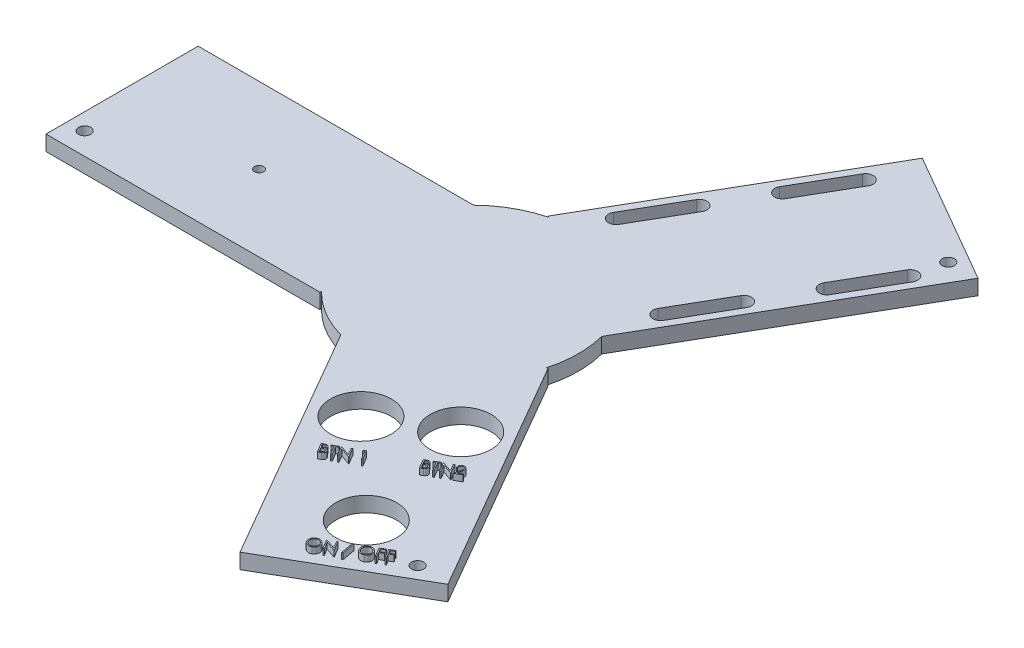
from build123d import *

# Parameters (mm, degrees)
BOSS_EXTRU_3_DEPTH      = 5
ESQUISSE5_R             = 10
ESQUISSE5_R_2           = 1.5
ENL_V_MAT_EXTRU_1_DEPTH = 161.669919512
ESQUISSE7_R             = 2
ENL_V_MAT_EXTRU_2_DEPTH = 10
BOSS_EXTRU_4_DEPTH      = 2


with BuildPart() as part:
    # Esquisse3 → Boss.-Extru.3 (new body)
    with BuildSketch(Plane(origin=(0, 0, 0), x_dir=(1, 0, 0), z_dir=(0, 1, 0))):
        with BuildLine():
            Line((-115, -25), (-25, -25))
            Line((-25, -25), (-24.99494949, -24.500051021))
            ThreePointArc((-24.99494949, -24.500051021), (-17.805293657, -30.132565736), (-9.403186381, -33.713203436))
            Line((-9.403186381, -33.713203436), (35.849364905, -112.092921435))
            Line((35.849364905, -112.092921435), (79.150635095, -87.092921435))
            Line((79.150635095, -87.092921435), (34.150635095, -9.150635095))
            Line((34.150635095, -9.150635095), (33.715141323, -9.396235714))
            ThreePointArc((33.715141323, -9.396235714), (34.998214236, -0.353553761), (33.898083809, 8.713203436))
            Line((33.898083809, 8.713203436), (79.150635095, 87.092921435))
            Line((79.150635095, 87.092921435), (35.849364905, 112.092921435))
            Line((35.849364905, 112.092921435), (-9.150635095, 34.150635095))
            Line((-9.150635095, 34.150635095), (-8.720191833, 33.896286735))
            ThreePointArc((-8.720191833, 33.896286735), (-17.19292058, 30.486119496), (-24.494897428, 25))
            Line((-24.494897428, 25), (-115, 25))
            Line((-115, 25), (-115, -25))
        make_face()
    extrude(amount=BOSS_EXTRU_3_DEPTH)

    # Esquisse5 → Enlèv. mat.-Extru.1 (cut, through all)
    with BuildSketch(Plane(origin=(0, 5, 0), x_dir=(1, 0, 0), z_dir=(0, 1, 0))):
        with BuildLine():
            Line((59.485571585, 58.032032303), (69.485571585, 75.352540378))
            ThreePointArc((69.485571585, 75.352540378), (68.570508076, 78.767603888), (65.155444566, 77.852540378))
            Line((65.155444566, 77.852540378), (55.155444566, 60.532032303))
            ThreePointArc((55.155444566, 60.532032303), (56.070508076, 57.116968793), (59.485571585, 58.032032303))
        make_face()
        with BuildLine():
            ThreePointArc((49.485571585, 40.711524227), (48.570508076, 44.126587737), (45.155444566, 43.211524227))
            Line((45.155444566, 43.211524227), (35.155444566, 25.891016151))
            ThreePointArc((35.155444566, 25.891016151), (36.070508076, 22.475952642), (39.485571585, 23.391016151))
            Line((39.485571585, 23.391016151), (49.485571585, 40.711524227))
        make_face()
        with BuildLine():
            ThreePointArc((20.514428415, 80.532032303), (21.429491924, 77.116968793), (24.844555434, 78.032032303))
            Line((24.844555434, 78.032032303), (34.844555434, 95.352540378))
            ThreePointArc((34.844555434, 95.352540378), (33.929491924, 98.767603888), (30.514428415, 97.852540378))
            Line((30.514428415, 97.852540378), (20.514428415, 80.532032303))
        make_face()
        with BuildLine():
            Line((10.514428415, 63.211524227), (0.514428415, 45.891016151))
            ThreePointArc((0.514428415, 45.891016151), (1.429491924, 42.475952642), (4.844555434, 43.391016151))
            Line((4.844555434, 43.391016151), (14.844555434, 60.711524227))
            ThreePointArc((14.844555434, 60.711524227), (13.929491924, 64.126587737), (10.514428415, 63.211524227))
        make_face()
        with Locations((47.5, -82.272413359)):
            Circle(ESQUISSE5_R)
        with Locations((-70, 0)):
            Circle(ESQUISSE5_R_2)
        with Locations((17.107695155, -53.631397208)):
            Circle(ESQUISSE5_R)
        with Locations((37.892304845, -41.631397208)):
            Circle(ESQUISSE5_R)
    extrude(amount=-ENL_V_MAT_EXTRU_1_DEPTH, mode=Mode.SUBTRACT)

    # Esquisse7 → Enlèv. mat.-Extru.2 (cut)
    with BuildSketch(Plane(origin=(0, 5, 0), x_dir=(1, 0, 0), z_dir=(0, 1, 0))):
        with Locations((69.722431864, 86.762794416)):
            Circle(ESQUISSE7_R)
        with Locations((-109.562568341, -17.757653858)):
            Circle(ESQUISSE7_R)
        with Locations((68.847568546, -86.762794416)):
            Circle(ESQUISSE7_R)
    extrude(amount=-ENL_V_MAT_EXTRU_2_DEPTH, mode=Mode.SUBTRACT)

    # Esquisse8 → Boss.-Extru.4 (add)
    # profile 1 of 14: a face of its own
    with BuildSketch(Plane(origin=(0, 5, 0), x_dir=(1, 0, 0), z_dir=(0, 1, 0))):
        with BuildLine():
            add(Edge.make_bspline(
                [(46.348522792, -97.586053463), (46.405503778, -97.555102837), (46.517663732, -97.494180394), (46.692297521, -97.421902491), (46.868328496, -97.367882687), (47.045849557, -97.333837549), (47.224280836, -97.316279004), (47.404056439, -97.318820115), (47.585091186, -97.339363632), (47.765377634, -97.377780108), (47.940925593, -97.432800451), (48.10820551, -97.502842435), (48.264467762, -97.588976654), (48.410594458, -97.689408434), (48.545030687, -97.806072132), (48.66874809, -97.937282993), (48.782886683, -98.082898468), (48.847899457, -98.189481549), (48.880974716, -98.243705707)],
                knots=[0, 0, 0, 0, 1.065304014, 2.096917889, 3.100711503, 4.086921898, 5.063206018, 6.042877862, 7.036430753, 8.053587743, 9.068122506, 10.05630619, 11.029433465, 11.995941318, 12.965559079, 13.949274792, 14.956693254, 16, 16, 16, 16], degree=3))
            add(Edge.make_bspline(
                [(48.880974716, -98.243705707), (48.911063825, -98.299021258), (48.970226315, -98.407785053), (49.038876531, -98.578364448), (49.09048604, -98.750321046), (49.124082064, -98.924840994), (49.137651126, -99.101405381), (49.134040592, -99.279840025), (49.113110516, -99.460307142), (49.072800376, -99.640365444), (49.017479335, -99.816191579), (48.947319225, -99.98372487), (48.861506016, -100.139990775), (48.760295013, -100.285329569), (48.645371328, -100.42032379), (48.514945274, -100.543793171), (48.37019178, -100.656821243), (48.264432042, -100.721542249), (48.21070228, -100.754422854)],
                knots=[0, 0, 0, 0, 1.043720089, 2.052206943, 3.04317604, 4.017816421, 4.99386645, 5.974776854, 6.973915512, 8.001918398, 9.030498486, 10.027627402, 11.009563614, 11.981633653, 12.96044316, 13.944771313, 14.955869685, 16, 16, 16, 16], degree=3))
            add(Edge.make_bspline(
                [(48.21070228, -100.754422854), (48.154960598, -100.785072437), (48.045246366, -100.845398847), (47.87287117, -100.913995029), (47.699810156, -100.967190789), (47.524069907, -100.999769327), (47.346792742, -101.015573736), (47.167756969, -101.012589636), (46.987182989, -100.991244224), (46.807264417, -100.95200615), (46.631594824, -100.897229865), (46.464688371, -100.827142656), (46.309011555, -100.741930578), (46.16445673, -100.642387884), (46.030362012, -100.529130243), (45.908002824, -100.400599493), (45.796384075, -100.257770769), (45.732431259, -100.153751151), (45.699985132, -100.100977342)],
                knots=[0, 0, 0, 0, 1.056025618, 2.078535076, 3.07607539, 4.060055105, 5.042332339, 6.028776198, 7.029666655, 8.058644315, 9.08415774, 10.083034931, 11.061420663, 12.0275854, 12.99464712, 13.972400756, 14.971308138, 16, 16, 16, 16], degree=3))
            add(Edge.make_bspline(
                [(45.699985132, -100.100977342), (45.67992532, -100.064508607), (45.640005676, -99.991934703), (45.588125686, -99.879882478), (45.544743363, -99.765603736), (45.507903558, -99.650153555), (45.479874966, -99.532459091), (45.45977679, -99.412966537), (45.44601455, -99.291744139), (45.441476782, -99.169213355), (45.444093611, -99.047210796), (45.454698889, -98.92659888), (45.472812227, -98.8082961), (45.498743952, -98.692313928), (45.532761946, -98.578798197), (45.57391418, -98.467422827), (45.623329944, -98.358362732), (45.680030831, -98.252061021), (45.743270591, -98.149550796), (45.813243698, -98.052418949), (45.888143843, -97.960393536), (45.968990574, -97.873989209), (46.055404344, -97.793151831), (46.147529848, -97.718084394), (46.245009253, -97.648195381), (46.313868913, -97.606857104), (46.348522792, -97.586053463)],
                knots=[0, 0, 0, 0, 1.036687703, 2.063040393, 3.072945872, 4.080179394, 5.079981601, 6.084046655, 7.097336534, 8.117029152, 9.136173113, 10.135585345, 11.131106452, 12.11561961, 13.093759664, 14.08116077, 15.071355823, 16.074137165, 17.080714218, 18.069538995, 19.054327561, 20.034700321, 21.015073081, 21.999861646, 22.993422946, 24, 24, 24, 24], degree=3))
        make_face()
        with BuildLine():
            add(Edge.make_bspline(
                [(46.534320068, -97.874214521), (46.506737767, -97.890907072), (46.452068548, -97.923992372), (46.374340216, -97.980085184), (46.301054285, -98.040782624), (46.231726515, -98.106607941), (46.166764132, -98.177055979), (46.106314279, -98.252793504), (46.049193679, -98.332418456), (45.998048844, -98.41722349), (45.950548801, -98.504223903), (45.911309784, -98.594261662), (45.876151257, -98.684668466), (45.849112315, -98.777238351), (45.827321009, -98.870824033), (45.811476473, -98.966103713), (45.803637244, -99.062703287), (45.800598576, -99.160302644), (45.803843066, -99.258032621), (45.814838522, -99.355391495), (45.831043786, -99.451849783), (45.855853005, -99.547052656), (45.884563159, -99.641817883), (45.9217291, -99.735171338), (45.964110754, -99.82824227), (45.997759358, -99.888293781), (46.014788818, -99.918685675)],
                knots=[0, 0, 0, 0, 0.989056773, 1.960349877, 2.938319158, 3.907279331, 4.891957881, 5.876505827, 6.879480388, 7.896713311, 8.913870383, 9.918791872, 10.908472525, 11.888753296, 12.875180253, 13.856169139, 14.849636618, 15.846953908, 16.851670635, 17.847232811, 18.851821541, 19.85027285, 20.864264395, 21.888451632, 22.931351577, 24, 24, 24, 24], degree=3))
            add(Edge.make_bspline(
                [(46.014788818, -99.918685675), (46.041229031, -99.96230379), (46.093236122, -100.048099291), (46.185827377, -100.164620553), (46.285011617, -100.270609133), (46.394126496, -100.363438558), (46.510695573, -100.445733093), (46.637280781, -100.514098785), (46.771665618, -100.572315342), (46.913784326, -100.616331877), (47.059037204, -100.6476446), (47.204069604, -100.665736056), (47.347126229, -100.668362068), (47.488363424, -100.65738796), (47.62761168, -100.631065626), (47.765052046, -100.590918489), (47.900425766, -100.536210286), (47.986763688, -100.489321021), (48.030513978, -100.465560675)],
                knots=[0, 0, 0, 0, 1.052030298, 2.069311486, 3.065878726, 4.044484931, 5.021567568, 6.006161727, 7.009027538, 8.040579081, 9.072062923, 10.073256091, 11.052872731, 12.02090789, 12.992747021, 13.972945674, 14.972824321, 16, 16, 16, 16], degree=3))
            add(Edge.make_bspline(
                [(48.030513978, -100.465560675), (48.059236785, -100.448128567), (48.116346776, -100.413468044), (48.197581753, -100.356096418), (48.273609013, -100.293881817), (48.345461073, -100.227838134), (48.412755193, -100.157343712), (48.474453151, -100.081668432), (48.532391106, -100.002450309), (48.584483187, -99.918588239), (48.63138975, -99.831989209), (48.672142946, -99.743464925), (48.70679889, -99.653357221), (48.734548596, -99.561673789), (48.756901308, -99.468592812), (48.770969856, -99.373774455), (48.78067354, -99.277614209), (48.782372953, -99.180129723), (48.778324264, -99.0824757), (48.767726077, -98.985278603), (48.750897561, -98.889253841), (48.727802746, -98.794055864), (48.697333975, -98.700047508), (48.660927618, -98.606819542), (48.618104976, -98.514521796), (48.585003261, -98.454784846), (48.568274395, -98.42459513)],
                knots=[0, 0, 0, 0, 1.027278423, 2.04255318, 3.038218543, 4.029565188, 5.025461382, 6.015596443, 7.013439751, 8.024807894, 9.032127512, 10.023474158, 11.003028664, 11.981957225, 12.951026501, 13.927473417, 14.91100897, 15.904671549, 16.906168241, 17.898261722, 18.892309764, 19.885561016, 20.891358236, 21.911977043, 22.944759978, 24, 24, 24, 24], degree=3))
            add(Edge.make_bspline(
                [(48.568274395, -98.42459513), (48.550624162, -98.395164158), (48.515797222, -98.337091797), (48.457957416, -98.254436805), (48.395340719, -98.177628659), (48.329683075, -98.104908918), (48.259085234, -98.03851808), (48.185528051, -97.97604931), (48.106657899, -97.920427595), (48.024872821, -97.869117565), (47.939796233, -97.823565805), (47.852639814, -97.783460318), (47.762700062, -97.750538955), (47.670999055, -97.722954294), (47.576717555, -97.702272216), (47.480368241, -97.686218115), (47.381651489, -97.678521921), (47.281707271, -97.675320826), (47.181750069, -97.679159048), (47.08311265, -97.687853649), (46.986400941, -97.703519766), (46.891723482, -97.725113143), (46.799103927, -97.753415543), (46.708357929, -97.787023702), (46.61965904, -97.826854021), (46.562854668, -97.858378697), (46.534320068, -97.874214521)],
                knots=[0, 0, 0, 0, 1.053686592, 2.079104582, 3.094629063, 4.095438722, 5.085380942, 6.068640285, 7.056472891, 8.046232977, 9.032029835, 10.018035681, 10.98993997, 11.970917813, 12.956453373, 13.952309776, 14.967935698, 15.99465893, 17.0216079, 18.037867598, 19.033724001, 20.027846115, 21.017762318, 22.005620996, 22.998161495, 24, 24, 24, 24], degree=3))
        make_face(mode=Mode.SUBTRACT)
    # profile 2 of 14: a face of its own
    with BuildSketch(Plane(origin=(0, 5, 0), x_dir=(1, 0, 0), z_dir=(0, 1, 0))):
        Polygon((50.353336675, -99.415280226), (48.603336675, -96.385732951), (48.669242124, -96.347872374), (52.02340879, -97.504022213), (50.68356504, -95.184711316), (50.982242925, -95.012235354), (52.732242925, -98.04178263), (52.664234111, -98.081045451), (49.343020169, -96.944527021), (50.666036996, -99.235091925), align=None)
    # profile 3 of 14: a face of its own
    with BuildSketch(Plane(origin=(0, 5, 0), x_dir=(1, 0, 0), z_dir=(0, 1, 0))):
        Polygon((54.185541392, -93.061714521), (54.95817761, -97.305604745), (54.643373925, -97.487896412), (53.867933219, -93.24470731), align=None)
    # profile 4 of 14: a face of its own
    with BuildSketch(Plane(origin=(0, 5, 0), x_dir=(1, 0, 0), z_dir=(0, 1, 0))):
        with BuildLine():
            add(Edge.make_bspline(
                [(57.268214903, -91.281566284), (57.325195889, -91.250615657), (57.437355843, -91.189693215), (57.611989632, -91.117415312), (57.788020607, -91.063395507), (57.965541668, -91.029350369), (58.143972946, -91.011791825), (58.323748549, -91.014332935), (58.504783297, -91.034876452), (58.685069744, -91.073292929), (58.860617703, -91.128313272), (59.027897621, -91.198355255), (59.184159872, -91.284489475), (59.330286568, -91.384921254), (59.464722797, -91.501584952), (59.588440201, -91.632795813), (59.702578793, -91.778411288), (59.767591568, -91.88499437), (59.800666826, -91.939218527)],
                knots=[0, 0, 0, 0, 1.065304014, 2.096917889, 3.100711503, 4.086921898, 5.063206018, 6.042877862, 7.036430753, 8.053587743, 9.068122506, 10.05630619, 11.029433465, 11.995941318, 12.965559079, 13.949274792, 14.956693254, 16, 16, 16, 16], degree=3))
            add(Edge.make_bspline(
                [(59.800666826, -91.939218527), (59.830755936, -91.994534078), (59.889918426, -92.103297873), (59.958568641, -92.273877269), (60.010178151, -92.445833866), (60.043774174, -92.620353814), (60.057343236, -92.796918201), (60.053732703, -92.975352845), (60.032802626, -93.155819962), (59.992492487, -93.335878265), (59.937171445, -93.511704399), (59.867011335, -93.67923769), (59.781198127, -93.835503595), (59.679987123, -93.98084239), (59.565063439, -94.11583661), (59.434637385, -94.239305992), (59.289883891, -94.352334063), (59.184124152, -94.417055069), (59.13039439, -94.449935675)],
                knots=[0, 0, 0, 0, 1.043720089, 2.052206943, 3.04317604, 4.017816421, 4.99386645, 5.974776854, 6.973915512, 8.001918398, 9.030498486, 10.027627402, 11.009563614, 11.981633653, 12.96044316, 13.944771313, 14.955869685, 16, 16, 16, 16], degree=3))
            add(Edge.make_bspline(
                [(59.13039439, -94.449935675), (59.074652709, -94.480585258), (58.964938476, -94.540911667), (58.79256328, -94.60950785), (58.619502267, -94.66270361), (58.443762018, -94.695282148), (58.266484852, -94.711086556), (58.08744908, -94.708102457), (57.906875099, -94.686757045), (57.726956528, -94.647518971), (57.551286934, -94.592742686), (57.384380481, -94.522655476), (57.228703665, -94.437443398), (57.084148841, -94.337900705), (56.950054122, -94.224643064), (56.827694934, -94.096112314), (56.716076186, -93.95328359), (56.652123369, -93.849263971), (56.619677243, -93.796490162)],
                knots=[0, 0, 0, 0, 1.056025618, 2.078535076, 3.07607539, 4.060055105, 5.042332339, 6.028776198, 7.029666655, 8.058644315, 9.08415774, 10.083034931, 11.061420663, 12.0275854, 12.99464712, 13.972400756, 14.971308138, 16, 16, 16, 16], degree=3))
            add(Edge.make_bspline(
                [(56.619677243, -93.796490162), (56.59961743, -93.760021427), (56.559697786, -93.687447524), (56.507817797, -93.575395299), (56.464435473, -93.461116557), (56.427595669, -93.345666375), (56.399567077, -93.227971912), (56.379468901, -93.108479357), (56.365706661, -92.987256959), (56.361168892, -92.864726175), (56.363785721, -92.742723616), (56.374390999, -92.622111701), (56.392504338, -92.503808921), (56.418436063, -92.387826749), (56.452454057, -92.274311018), (56.493606291, -92.162935648), (56.543022055, -92.053875553), (56.599722942, -91.947573841), (56.662962702, -91.845063617), (56.732935809, -91.747931769), (56.807835953, -91.655906356), (56.888682685, -91.569502029), (56.975096455, -91.488664652), (57.067221959, -91.413597214), (57.164701363, -91.343708201), (57.233561023, -91.302369925), (57.268214903, -91.281566284)],
                knots=[0, 0, 0, 0, 1.036687703, 2.063040393, 3.072945872, 4.080179394, 5.079981601, 6.084046655, 7.097336534, 8.117029152, 9.136173113, 10.135585345, 11.131106452, 12.11561961, 13.093759664, 14.08116077, 15.071355823, 16.074137165, 17.080714218, 18.069538995, 19.054327561, 20.034700321, 21.015073081, 21.999861646, 22.993422946, 24, 24, 24, 24], degree=3))
        make_face()
        with BuildLine():
            add(Edge.make_bspline(
                [(57.454012179, -91.569727342), (57.426429877, -91.586419893), (57.371760659, -91.619505193), (57.294032327, -91.675598005), (57.220746396, -91.736295444), (57.151418625, -91.802120762), (57.086456243, -91.8725688), (57.026006389, -91.948306325), (56.968885789, -92.027931277), (56.917740954, -92.11273631), (56.870240912, -92.199736724), (56.831001894, -92.289774483), (56.795843368, -92.380181287), (56.768804426, -92.472751171), (56.747013119, -92.566336854), (56.731168583, -92.661616533), (56.723329354, -92.758216108), (56.720290687, -92.855815464), (56.723535176, -92.953545441), (56.734530632, -93.050904316), (56.750735897, -93.147362603), (56.775545115, -93.242565477), (56.804255269, -93.337330704), (56.841421211, -93.430684158), (56.883802864, -93.52375509), (56.917451469, -93.583806602), (56.934480929, -93.614198495)],
                knots=[0, 0, 0, 0, 0.989056773, 1.960349877, 2.938319158, 3.907279331, 4.891957881, 5.876505827, 6.879480388, 7.896713311, 8.913870383, 9.918791872, 10.908472525, 11.888753296, 12.875180253, 13.856169139, 14.849636618, 15.846953908, 16.851670635, 17.847232811, 18.851821541, 19.85027285, 20.864264395, 21.888451632, 22.931351577, 24, 24, 24, 24], degree=3))
            add(Edge.make_bspline(
                [(56.934480929, -93.614198495), (56.960921141, -93.65781661), (57.012928232, -93.743612111), (57.105519488, -93.860133374), (57.204703728, -93.966121954), (57.313818607, -94.058951379), (57.430387683, -94.141245914), (57.556972891, -94.209611605), (57.691357728, -94.267828162), (57.833476436, -94.311844698), (57.978729315, -94.343157421), (58.123761715, -94.361248877), (58.26681834, -94.363874888), (58.408055534, -94.35290078), (58.547303791, -94.326578447), (58.684744156, -94.286431309), (58.820117876, -94.231723106), (58.906455799, -94.184833842), (58.950206089, -94.161073495)],
                knots=[0, 0, 0, 0, 1.052030298, 2.069311486, 3.065878726, 4.044484931, 5.021567568, 6.006161727, 7.009027538, 8.040579081, 9.072062923, 10.073256091, 11.052872731, 12.02090789, 12.992747021, 13.972945674, 14.972824321, 16, 16, 16, 16], degree=3))
            add(Edge.make_bspline(
                [(58.950206089, -94.161073495), (58.978928896, -94.143641388), (59.036038886, -94.108980865), (59.117273864, -94.051609238), (59.193301124, -93.989394638), (59.265153183, -93.923350955), (59.332447303, -93.852856533), (59.394145262, -93.777181252), (59.452083216, -93.697963129), (59.504175297, -93.61410106), (59.55108186, -93.52750203), (59.591835057, -93.438977746), (59.626491001, -93.348870042), (59.654240706, -93.25718661), (59.676593419, -93.164105632), (59.690661966, -93.069287275), (59.700365651, -92.97312703), (59.702065063, -92.875642544), (59.698016375, -92.77798852), (59.687418188, -92.680791423), (59.670589671, -92.584766661), (59.647494856, -92.489568685), (59.617026086, -92.395560328), (59.580619728, -92.302332362), (59.537797087, -92.210034616), (59.504695371, -92.150297667), (59.487966506, -92.120107951)],
                knots=[0, 0, 0, 0, 1.027278423, 2.04255318, 3.038218543, 4.029565188, 5.025461382, 6.015596443, 7.013439751, 8.024807894, 9.032127512, 10.023474158, 11.003028664, 11.981957225, 12.951026501, 13.927473417, 14.91100897, 15.904671549, 16.906168241, 17.898261722, 18.892309764, 19.885561016, 20.891358236, 21.911977043, 22.944759978, 24, 24, 24, 24], degree=3))
            add(Edge.make_bspline(
                [(59.487966506, -92.120107951), (59.470316273, -92.090676979), (59.435489333, -92.032604618), (59.377649527, -91.949949626), (59.31503283, -91.87314148), (59.249375186, -91.800421738), (59.178777345, -91.7340309), (59.105220162, -91.67156213), (59.026350009, -91.615940415), (58.944564931, -91.564630386), (58.859488344, -91.519078626), (58.772331924, -91.478973139), (58.682392172, -91.446051776), (58.590691166, -91.418467114), (58.496409666, -91.397785036), (58.400060351, -91.381730936), (58.301343599, -91.374034742), (58.201399382, -91.370833647), (58.10144218, -91.374671868), (58.002804761, -91.38336647), (57.906093052, -91.399032586), (57.811415593, -91.420625963), (57.718796038, -91.448928363), (57.628050039, -91.482536522), (57.539351151, -91.522366841), (57.482546779, -91.553891518), (57.454012179, -91.569727342)],
                knots=[0, 0, 0, 0, 1.053686592, 2.079104582, 3.094629063, 4.095438722, 5.085380942, 6.068640285, 7.056472891, 8.046232977, 9.032029835, 10.018035681, 10.98993997, 11.970917813, 12.956453373, 13.952309776, 14.967935698, 15.99465893, 17.0216079, 18.037867598, 19.033724001, 20.027846115, 21.017762318, 22.005620996, 22.998161495, 24, 24, 24, 24], degree=3))
        make_face(mode=Mode.SUBTRACT)
    # profile 5 of 14: a face of its own
    with BuildSketch(Plane(origin=(0, 5, 0), x_dir=(1, 0, 0), z_dir=(0, 1, 0))):
        Polygon((59.52092542, -90.082648015), (61.038854106, -89.206245771), (61.212031189, -89.504923656), (59.994883754, -90.207447694), (60.541758754, -91.154663239), (61.758906189, -90.452139201), (61.931382151, -90.750817085), (60.714234715, -91.453341124), (61.57170667, -92.938317085), (61.27092542, -93.11219529), align=None)
    # profile 6 of 14: a face of its own
    with BuildSketch(Plane(origin=(0, 5, 0), x_dir=(1, 0, 0), z_dir=(0, 1, 0))):
        Polygon((61.541651362, -88.915981348), (63.059580048, -88.039579104), (63.232757132, -88.338256989), (62.015609696, -89.040781027), (62.562484696, -89.987996572), (63.779632132, -89.285472534), (63.952108093, -89.584150418), (62.734960657, -90.286674457), (63.592432612, -91.771650418), (63.291651362, -91.945528624), align=None)
    # profile 7 of 14: a face of its own
    with BuildSketch(Plane(origin=(0, 5, 0), x_dir=(1, 0, 0), z_dir=(0, 1, 0))):
        with BuildLine():
            Line((20.281734937, -69.84100232), (20.878389585, -69.496751518))
            add(Edge.make_bspline(
                [(20.878389585, -69.496751518), (20.907753716, -69.480241315), (20.964909179, -69.448105226), (21.049317161, -69.403905057), (21.130435846, -69.365637509), (21.207981257, -69.333641726), (21.281465049, -69.306493667), (21.351635938, -69.286255413), (21.417719872, -69.270303819), (21.500769881, -69.25841226), (21.60106686, -69.254876948), (21.718598965, -69.267156372), (21.832508085, -69.298018894), (21.941091616, -69.3457583), (22.042979536, -69.407792343), (22.133950191, -69.484489765), (22.214864315, -69.573419873), (22.257559862, -69.64162147), (22.279230931, -69.676238698)],
                knots=[0, 0, 0, 0, 1.00882277, 1.963611082, 2.852810412, 3.693764693, 4.475302011, 5.197315872, 5.87981379, 6.509331813, 7.706891572, 8.875530348, 10.035100883, 11.22615964, 12.416930468, 13.594442862, 14.779006292, 16, 16, 16, 16], degree=3))
            add(Edge.make_bspline(
                [(22.279230931, -69.676238698), (22.297000098, -69.70993641), (22.331959724, -69.776234364), (22.367743485, -69.882337899), (22.389246645, -69.990787273), (22.394333603, -70.101444323), (22.38602935, -70.212817689), (22.358734108, -70.323124951), (22.317935111, -70.433172599), (22.277964434, -70.501980798), (22.257496155, -70.537216262)],
                knots=[0, 0, 0, 0, 1.007082055, 1.981365386, 2.951988574, 3.924522265, 4.905285294, 5.897146089, 6.923165649, 8, 8, 8, 8], degree=3))
            add(Edge.make_bspline(
                [(22.257496155, -70.537216262), (22.302732292, -70.529061048), (22.389085487, -70.513493212), (22.513857302, -70.50183854), (22.627055247, -70.502240776), (22.729856958, -70.513176314), (22.824953424, -70.535216595), (22.914411289, -70.568151856), (23.000836787, -70.60943954), (23.082290012, -70.661509737), (23.159089405, -70.721641049), (23.228541263, -70.790694008), (23.291349935, -70.86791115), (23.326391551, -70.92474334), (23.344234937, -70.953682608)],
                knots=[0, 0, 0, 0, 1.318574814, 2.517083834, 3.590090243, 4.561719895, 5.477546529, 6.383374621, 7.292176711, 8.220562028, 9.151656128, 10.085836364, 11.025297208, 12, 12, 12, 12], degree=3))
            add(Edge.make_bspline(
                [(23.344234937, -70.953682608), (23.360852853, -70.983951793), (23.393549002, -71.043507143), (23.429454852, -71.137580275), (23.45661287, -71.23228234), (23.47383128, -71.328361266), (23.478963791, -71.42621152), (23.474999163, -71.525124319), (23.459917221, -71.62541193), (23.434718622, -71.725627261), (23.400024744, -71.824574285), (23.354075459, -71.919744393), (23.297719581, -72.010304911), (23.231452659, -72.096461133), (23.154274419, -72.177347496), (23.067119813, -72.253653802), (22.969841758, -72.325760495), (22.899392192, -72.368410223), (22.863265386, -72.390281166)],
                knots=[0, 0, 0, 0, 0.975398264, 1.91911956, 2.839577739, 3.758730218, 4.672234973, 5.604877378, 6.553491324, 7.534403573, 8.523054412, 9.513228071, 10.516350308, 11.534145836, 12.581254995, 13.672298889, 14.806346004, 16, 16, 16, 16], degree=3))
            Line((22.863265386, -72.390281166), (22.031734937, -72.870549595))
            Line((22.031734937, -72.870549595), (20.281734937, -69.84100232))
        make_face()
        with BuildLine():
            Line((20.750084296, -69.966503121), (21.31028061, -70.936154563))
            Line((21.31028061, -70.936154563), (21.482756572, -70.836595268))
            add(Edge.make_bspline(
                [(21.482756572, -70.836595268), (21.508116067, -70.821832991), (21.557179989, -70.793271884), (21.626160879, -70.748826566), (21.689760455, -70.706992584), (21.746762363, -70.665755943), (21.7968607, -70.624729531), (21.842341365, -70.586812804), (21.880207487, -70.548715032), (21.922199108, -70.500387787), (21.96531312, -70.438328583), (22.003186722, -70.358796626), (22.030149056, -70.275903648), (22.041841868, -70.189660085), (22.043375034, -70.102967843), (22.030016446, -70.017759597), (22.005489258, -69.934681476), (21.978201519, -69.883609365), (21.964427245, -69.857829243)],
                knots=[0, 0, 0, 0, 1.137489387, 2.200741407, 3.180822876, 4.0888093, 4.926534352, 5.69114394, 6.383099183, 7.006193662, 8.172371991, 9.298983002, 10.410850136, 11.537206064, 12.66078879, 13.760255669, 14.869424406, 16, 16, 16, 16], degree=3))
            add(Edge.make_bspline(
                [(21.964427245, -69.857829243), (21.954195788, -69.841281121), (21.934151431, -69.808861843), (21.899993493, -69.764576013), (21.862256768, -69.726354098), (21.82200808, -69.69300397), (21.778717921, -69.664700322), (21.731721459, -69.643117164), (21.682487107, -69.626046001), (21.630029804, -69.61463982), (21.574468934, -69.610014672), (21.51587864, -69.611271485), (21.454251061, -69.620455096), (21.389026475, -69.634731715), (21.321146709, -69.657940072), (21.249888802, -69.686756163), (21.175635984, -69.722762527), (21.125757602, -69.750318841), (21.099944072, -69.764580044)],
                knots=[0, 0, 0, 0, 0.944679052, 1.850712253, 2.709650896, 3.548321, 4.385914801, 5.213681072, 6.053732967, 6.913196565, 7.813522414, 8.756016286, 9.752995404, 10.835317034, 11.994839053, 13.232264863, 14.56761565, 16, 16, 16, 16], degree=3))
            Line((21.099944072, -69.764580044), (20.750084296, -69.966503121))
        make_face(mode=Mode.SUBTRACT)
        with BuildLine():
            Line((21.486262181, -71.241142544), (22.157235739, -72.402901358))
            Line((22.157235739, -72.402901358), (22.531634777, -72.186955845))
            add(Edge.make_bspline(
                [(22.531634777, -72.186955845), (22.558124585, -72.171196333), (22.60935515, -72.140717868), (22.682278284, -72.094395648), (22.748851585, -72.049757042), (22.808799043, -72.006406371), (22.861373948, -71.963695166), (22.907147235, -71.922166227), (22.946880452, -71.88224747), (22.990260993, -71.830656553), (23.034002442, -71.763508427), (23.073497404, -71.67850794), (23.099933298, -71.588447784), (23.11261298, -71.495423423), (23.114131034, -71.4016479), (23.100108498, -71.310633998), (23.074985205, -71.222709236), (23.046547934, -71.169210001), (23.032235739, -71.142284371)],
                knots=[0, 0, 0, 0, 1.128202246, 2.181912311, 3.161815519, 4.061839135, 4.888852637, 5.639808157, 6.323373699, 6.948796293, 8.104300804, 9.244889197, 10.368281156, 11.526063399, 12.672411729, 13.787860727, 14.886652404, 16, 16, 16, 16], degree=3))
            add(Edge.make_bspline(
                [(23.032235739, -71.142284371), (23.011877636, -71.110329246), (22.971936306, -71.047635284), (22.892736642, -70.969204742), (22.800839774, -70.907383435), (22.697145081, -70.862618171), (22.584515817, -70.835485532), (22.465472086, -70.82628421), (22.340732164, -70.837127332), (22.258185179, -70.858485328), (22.215428848, -70.869547993)],
                knots=[0, 0, 0, 0, 0.972184658, 1.907365689, 2.84273992, 3.806561865, 4.79657477, 5.809537921, 6.865420418, 8, 8, 8, 8], degree=3))
            add(Edge.make_bspline(
                [(22.215428848, -70.869547993), (22.199714641, -70.874526537), (22.165585855, -70.885339151), (22.111979563, -70.906434113), (22.052440502, -70.933841692), (21.985269068, -70.964233928), (21.912414271, -71.001602729), (21.832691829, -71.043868642), (21.746780063, -71.091506508), (21.68744585, -71.12539031), (21.656634777, -71.142985493)],
                knots=[0, 0, 0, 0, 0.634679512, 1.378424079, 2.21639655, 3.158655646, 4.217224558, 5.368704359, 6.633620638, 8, 8, 8, 8], degree=3))
            Line((21.656634777, -71.142985493), (21.486262181, -71.241142544))
        make_face(mode=Mode.SUBTRACT)
    # profile 8 of 14: a face of its own
    with BuildSketch(Plane(origin=(0, 5, 0), x_dir=(1, 0, 0), z_dir=(0, 1, 0))):
        Polygon((22.55923519, -68.935421052), (22.388862594, -68.640949898), (24.051222369, -67.681114161), (24.221594965, -67.975585315), (23.545713555, -68.365409033), (25.125340959, -71.100485155), (24.816146247, -71.279271212), (23.236518844, -68.544195091), align=None)
    # profile 9 of 14: a face of its own
    with BuildSketch(Plane(origin=(0, 5, 0), x_dir=(1, 0, 0), z_dir=(0, 1, 0))):
        Polygon((26.234502514, -70.472207531), (24.484502514, -67.442660256), (24.550407963, -67.404799679), (27.904574629, -68.560949518), (26.564730879, -66.241638621), (26.863408764, -66.069162659), (28.613408764, -69.098709935), (28.54539995, -69.137972756), (25.224186008, -68.001454326), (26.547202835, -70.29201923), align=None)
    # profile 10 of 14: a face of its own
    with BuildSketch(Plane(origin=(0, 5, 0), x_dir=(1, 0, 0), z_dir=(0, 1, 0))):
        Polygon((29.180981198, -64.760055877), (29.776233602, -64.416506197), (31.526233602, -67.446053473), (31.225452352, -67.619931678), (29.647227191, -64.886958922), (29.171866615, -65.161097544), align=None)
    # profile 11 of 14: a face of its own
    with BuildSketch(Plane(origin=(0, 5, 0), x_dir=(1, 0, 0), z_dir=(0, 1, 0))):
        with BuildLine():
            Line((41.638906833, -57.653849312), (42.23556148, -57.30959851))
            add(Edge.make_bspline(
                [(42.23556148, -57.30959851), (42.264925611, -57.293088307), (42.322081074, -57.260952218), (42.406489056, -57.216752049), (42.487607741, -57.178484501), (42.565153152, -57.146488718), (42.638636944, -57.119340659), (42.708807834, -57.099102405), (42.774891767, -57.083150811), (42.857941777, -57.071259252), (42.958238755, -57.06772394), (43.07577086, -57.080003364), (43.18967998, -57.110865886), (43.298263511, -57.158605292), (43.400151431, -57.220639335), (43.491122087, -57.297336757), (43.57203621, -57.386266865), (43.614731757, -57.454468462), (43.636402826, -57.48908569)],
                knots=[0, 0, 0, 0, 1.00882277, 1.963611082, 2.852810412, 3.693764693, 4.475302011, 5.197315872, 5.87981379, 6.509331813, 7.706891572, 8.875530348, 10.035100883, 11.22615964, 12.416930468, 13.594442862, 14.779006292, 16, 16, 16, 16], degree=3))
            add(Edge.make_bspline(
                [(43.636402826, -57.48908569), (43.654171993, -57.522783402), (43.689131619, -57.589081356), (43.72491538, -57.695184891), (43.74641854, -57.803634265), (43.751505498, -57.914291315), (43.743201245, -58.025664681), (43.715906004, -58.135971943), (43.675107007, -58.246019591), (43.635136329, -58.31482779), (43.614668051, -58.350063254)],
                knots=[0, 0, 0, 0, 1.007082055, 1.981365386, 2.951988574, 3.924522265, 4.905285294, 5.897146089, 6.923165649, 8, 8, 8, 8], degree=3))
            add(Edge.make_bspline(
                [(43.614668051, -58.350063254), (43.659904187, -58.34190804), (43.746257382, -58.326340204), (43.871029197, -58.314685532), (43.984227142, -58.315087768), (44.087028853, -58.326023306), (44.18212532, -58.348063587), (44.271583185, -58.380998848), (44.358008682, -58.422286532), (44.439461907, -58.474356729), (44.516261301, -58.534488042), (44.585713159, -58.603541), (44.648521831, -58.680758142), (44.683563447, -58.737590332), (44.701406833, -58.7665296)],
                knots=[0, 0, 0, 0, 1.318574814, 2.517083834, 3.590090243, 4.561719895, 5.477546529, 6.383374621, 7.292176711, 8.220562028, 9.151656128, 10.085836364, 11.025297208, 12, 12, 12, 12], degree=3))
            add(Edge.make_bspline(
                [(44.701406833, -58.7665296), (44.718024748, -58.796798785), (44.750720897, -58.856354135), (44.786626748, -58.950427267), (44.813784765, -59.045129332), (44.831003175, -59.141208258), (44.836135686, -59.239058512), (44.832171059, -59.337971311), (44.817089116, -59.438258922), (44.791890518, -59.538474253), (44.757196639, -59.637421277), (44.711247355, -59.732591385), (44.654891476, -59.823151903), (44.588624554, -59.909308125), (44.511446314, -59.990194488), (44.424291708, -60.066500794), (44.327013653, -60.138607487), (44.256564087, -60.181257215), (44.220437282, -60.203128158)],
                knots=[0, 0, 0, 0, 0.975398264, 1.91911956, 2.839577739, 3.758730218, 4.672234973, 5.604877378, 6.553491324, 7.534403573, 8.523054412, 9.513228071, 10.516350308, 11.534145836, 12.581254995, 13.672298889, 14.806346004, 16, 16, 16, 16], degree=3))
            Line((44.220437282, -60.203128158), (43.388906833, -60.683396587))
            Line((43.388906833, -60.683396587), (41.638906833, -57.653849312))
        make_face()
        with BuildLine():
            Line((42.107256192, -57.779350113), (42.667452506, -58.749001555))
            Line((42.667452506, -58.749001555), (42.839928467, -58.64944226))
            add(Edge.make_bspline(
                [(42.839928467, -58.64944226), (42.865287962, -58.634679983), (42.914351884, -58.606118876), (42.983332774, -58.561673558), (43.046932351, -58.519839576), (43.103934259, -58.478602935), (43.154032595, -58.437576523), (43.19951326, -58.399659796), (43.237379383, -58.361562024), (43.279371003, -58.313234779), (43.322485016, -58.251175575), (43.360358617, -58.171643618), (43.387320951, -58.08875064), (43.399013763, -58.002507077), (43.40054693, -57.915814835), (43.387188342, -57.830606589), (43.362661153, -57.747528468), (43.335373414, -57.696456357), (43.32159914, -57.670676235)],
                knots=[0, 0, 0, 0, 1.137489387, 2.200741407, 3.180822876, 4.0888093, 4.926534352, 5.69114394, 6.383099183, 7.006193662, 8.172371991, 9.298983002, 10.410850136, 11.537206064, 12.66078879, 13.760255669, 14.869424406, 16, 16, 16, 16], degree=3))
            add(Edge.make_bspline(
                [(43.32159914, -57.670676235), (43.311367683, -57.654128113), (43.291323327, -57.621708835), (43.257165388, -57.577423005), (43.219428663, -57.53920109), (43.179179975, -57.505850962), (43.135889817, -57.477547314), (43.088893355, -57.455964156), (43.039659003, -57.438892993), (42.987201699, -57.427486812), (42.931640829, -57.422861664), (42.873050535, -57.424118477), (42.811422957, -57.433302088), (42.74619837, -57.447578707), (42.678318605, -57.470787064), (42.607060697, -57.499603155), (42.532807879, -57.535609519), (42.482929497, -57.563165833), (42.457115967, -57.577427036)],
                knots=[0, 0, 0, 0, 0.944679052, 1.850712253, 2.709650896, 3.548321, 4.385914801, 5.213681072, 6.053732967, 6.913196565, 7.813522414, 8.756016286, 9.752995404, 10.835317034, 11.994839053, 13.232264863, 14.56761565, 16, 16, 16, 16], degree=3))
            Line((42.457115967, -57.577427036), (42.107256192, -57.779350113))
        make_face(mode=Mode.SUBTRACT)
        with BuildLine():
            Line((42.843434076, -59.053989536), (43.514407634, -60.21574835))
            Line((43.514407634, -60.21574835), (43.888806673, -59.999802837))
            add(Edge.make_bspline(
                [(43.888806673, -59.999802837), (43.915296481, -59.984043325), (43.966527046, -59.95356486), (44.03945018, -59.90724264), (44.106023481, -59.862604034), (44.165970939, -59.819253363), (44.218545843, -59.776542158), (44.26431913, -59.735013219), (44.304052348, -59.695094462), (44.347432888, -59.643503545), (44.391174338, -59.576355419), (44.430669299, -59.491354932), (44.457105193, -59.401294776), (44.469784875, -59.308270415), (44.471302929, -59.214494892), (44.457280393, -59.12348099), (44.432157101, -59.035556228), (44.403719829, -58.982056993), (44.389407634, -58.955131363)],
                knots=[0, 0, 0, 0, 1.128202246, 2.181912311, 3.161815519, 4.061839135, 4.888852637, 5.639808157, 6.323373699, 6.948796293, 8.104300804, 9.244889197, 10.368281156, 11.526063399, 12.672411729, 13.787860727, 14.886652404, 16, 16, 16, 16], degree=3))
            add(Edge.make_bspline(
                [(44.389407634, -58.955131363), (44.369049531, -58.923176238), (44.329108202, -58.860482276), (44.249908537, -58.782051734), (44.158011669, -58.720230427), (44.054316977, -58.675465163), (43.941687712, -58.648332524), (43.822643982, -58.639131202), (43.697904059, -58.649974324), (43.615357075, -58.67133232), (43.572600743, -58.682394985)],
                knots=[0, 0, 0, 0, 0.972184658, 1.907365689, 2.84273992, 3.806561865, 4.79657477, 5.809537921, 6.865420418, 8, 8, 8, 8], degree=3))
            add(Edge.make_bspline(
                [(43.572600743, -58.682394985), (43.556886536, -58.687373529), (43.52275775, -58.698186143), (43.469151458, -58.719281105), (43.409612397, -58.746688684), (43.342440964, -58.77708092), (43.269586166, -58.814449721), (43.189863724, -58.856715634), (43.103951958, -58.9043535), (43.044617746, -58.938237302), (43.013806673, -58.955832485)],
                knots=[0, 0, 0, 0, 0.634679512, 1.378424079, 2.21639655, 3.158655646, 4.217224558, 5.368704359, 6.633620638, 8, 8, 8, 8], degree=3))
            Line((43.013806673, -58.955832485), (42.843434076, -59.053989536))
        make_face(mode=Mode.SUBTRACT)
    # profile 12 of 14: a face of its own
    with BuildSketch(Plane(origin=(0, 5, 0), x_dir=(1, 0, 0), z_dir=(0, 1, 0))):
        Polygon((43.916407085, -56.748268044), (43.746034489, -56.45379689), (45.408394265, -55.493961153), (45.578766861, -55.788432307), (44.902885451, -56.178256025), (46.482512854, -58.913332147), (46.173318143, -59.092118204), (44.593690739, -56.357042083), align=None)
    # profile 13 of 14: a face of its own
    with BuildSketch(Plane(origin=(0, 5, 0), x_dir=(1, 0, 0), z_dir=(0, 1, 0))):
        Polygon((47.591674409, -58.285054523), (45.841674409, -55.255507248), (45.907579858, -55.217646671), (49.261746525, -56.37379651), (47.921902775, -54.054485613), (48.220580659, -53.882009651), (49.970580659, -56.911556927), (49.902571845, -56.950819748), (46.581357903, -55.814301318), (47.90437473, -58.104866222), align=None)
    # profile 14 of 14: a face of its own
    with BuildSketch(Plane(origin=(0, 5, 0), x_dir=(1, 0, 0), z_dir=(0, 1, 0))):
        with BuildLine():
            Line((49.624874306, -54.358372041), (49.334609883, -54.52594015))
            add(Edge.make_bspline(
                [(49.334609883, -54.52594015), (49.315157867, -54.488425355), (49.276891762, -54.414626057), (49.233397815, -54.299883222), (49.199477799, -54.185670885), (49.178721931, -54.071163036), (49.16863089, -53.956843088), (49.170142498, -53.842707488), (49.182663479, -53.728504147), (49.207322481, -53.615636516), (49.242150662, -53.506032327), (49.286542865, -53.401832371), (49.339546379, -53.303432745), (49.404286379, -53.213169201), (49.476419411, -53.128050868), (49.559367978, -53.051081514), (49.650722953, -52.97933658), (49.717676383, -52.938411079), (49.751777351, -52.917566753)],
                knots=[0, 0, 0, 0, 1.095282936, 2.154646258, 3.17720595, 4.181928296, 5.167652369, 6.149790891, 7.137898102, 8.142620448, 9.141473397, 10.116570871, 11.076934142, 12.033943277, 12.992621363, 13.966134661, 14.964104222, 16, 16, 16, 16], degree=3))
            add(Edge.make_bspline(
                [(49.751777351, -52.917566753), (49.78627681, -52.89868565), (49.853881481, -52.861686498), (49.958954567, -52.818244498), (50.063612632, -52.78576794), (50.168307138, -52.764091431), (50.273000524, -52.755217073), (50.377358179, -52.757210868), (50.481485643, -52.77075186), (50.584129831, -52.795473067), (50.684079111, -52.828556589), (50.778197236, -52.871316234), (50.867237061, -52.919767455), (50.948603451, -52.978016665), (51.024272351, -53.042684157), (51.093386457, -53.115458747), (51.155969989, -53.196147676), (51.191941704, -53.254686189), (51.210110684, -53.284253451)],
                knots=[0, 0, 0, 0, 1.123370733, 2.201342023, 3.242939719, 4.25161303, 5.250641824, 6.239413307, 7.22946995, 8.24530558, 9.252850335, 10.23353436, 11.19631197, 12.14517952, 13.087748971, 14.037392037, 15.008704871, 16, 16, 16, 16], degree=3))
            add(Edge.make_bspline(
                [(51.210110684, -53.284253451), (51.232920233, -53.327454795), (51.278217811, -53.413248523), (51.326930045, -53.550396349), (51.355898461, -53.692698875), (51.367053172, -53.815496894), (51.365525862, -53.920005472), (51.360548297, -54.007947978), (51.351123628, -54.105199128), (51.33787904, -54.211623166), (51.319551414, -54.327353157), (51.295750476, -54.452197089), (51.269815278, -54.586602342), (51.248935503, -54.67883995), (51.238155556, -54.726460983)],
                knots=[0, 0, 0, 0, 1.186888703, 2.357047186, 3.523999674, 4.710480142, 5.347000729, 6.064162024, 6.851887177, 7.722424512, 8.671688502, 9.700498606, 10.812798412, 12, 12, 12, 12], degree=3))
            Line((51.238155556, -54.726460983), (50.954201229, -55.9751589))
            Line((50.954201229, -55.9751589), (52.35293921, -55.167466592))
            Line((52.35293921, -55.167466592), (52.521909562, -55.459834381))
            Line((52.521909562, -55.459834381), (50.464117094, -56.648235823))
            Line((50.464117094, -56.648235823), (50.899513729, -54.72926547))
            add(Edge.make_bspline(
                [(50.899513729, -54.72926547), (50.910180935, -54.682791024), (50.930733265, -54.593249479), (50.957880201, -54.463951355), (50.981303724, -54.345034376), (51.000291408, -54.236806374), (51.014865, -54.1390426), (51.026799623, -54.051968515), (51.033049273, -53.975189296), (51.036183544, -53.88765266), (51.030581405, -53.786915588), (51.008415277, -53.672105588), (50.973497799, -53.561659575), (50.937297836, -53.494108785), (50.919145139, -53.460235022)],
                knots=[0, 0, 0, 0, 1.319013454, 2.541321333, 3.654536807, 4.671697523, 5.58052685, 6.388829791, 7.102353416, 7.71037053, 8.811316192, 9.883995718, 10.938916503, 12, 12, 12, 12], degree=3))
            add(Edge.make_bspline(
                [(50.919145139, -53.460235022), (50.906431211, -53.439654631), (50.881377022, -53.399098712), (50.837588827, -53.343009973), (50.788253574, -53.293688405), (50.735344127, -53.24847507), (50.676849988, -53.210343073), (50.614223738, -53.176777959), (50.546167274, -53.150594828), (50.47506446, -53.128797938), (50.401527241, -53.114219332), (50.328067891, -53.106477041), (50.255027539, -53.105578072), (50.182811723, -53.112461115), (50.111437985, -53.127900783), (50.040331022, -53.148608522), (49.969775072, -53.177433279), (49.924725841, -53.202231836), (49.901817415, -53.214842394)],
                knots=[0, 0, 0, 0, 0.997168774, 1.965030432, 2.925957377, 3.869964327, 4.829585434, 5.799604023, 6.794674719, 7.831348259, 8.863352075, 9.880853097, 10.873587394, 11.87094245, 12.865172675, 13.880617629, 14.922252107, 16, 16, 16, 16], degree=3))
            add(Edge.make_bspline(
                [(49.901817415, -53.214842394), (49.87836002, -53.22909758), (49.832391008, -53.257033198), (49.769817918, -53.306365547), (49.712604452, -53.358283932), (49.663150152, -53.416186183), (49.619678228, -53.477524837), (49.582757469, -53.543565001), (49.552785255, -53.613915476), (49.528763594, -53.687969506), (49.512816663, -53.76531738), (49.504147413, -53.844691587), (49.504551242, -53.925959196), (49.512123262, -54.009090569), (49.528721516, -54.094147181), (49.552676432, -54.181067664), (49.5841926, -54.270061234), (49.611077739, -54.328422807), (49.624874306, -54.358372041)],
                knots=[0, 0, 0, 0, 1.005170463, 1.969813475, 2.915404486, 3.832435459, 4.754533271, 5.667233306, 6.599657637, 7.553207593, 8.5158328, 9.489221553, 10.474299481, 11.489457431, 12.544489203, 13.645864792, 14.791935452, 16, 16, 16, 16], degree=3))
        make_face()
    extrude(amount=BOSS_EXTRU_4_DEPTH)


solid = part.part
